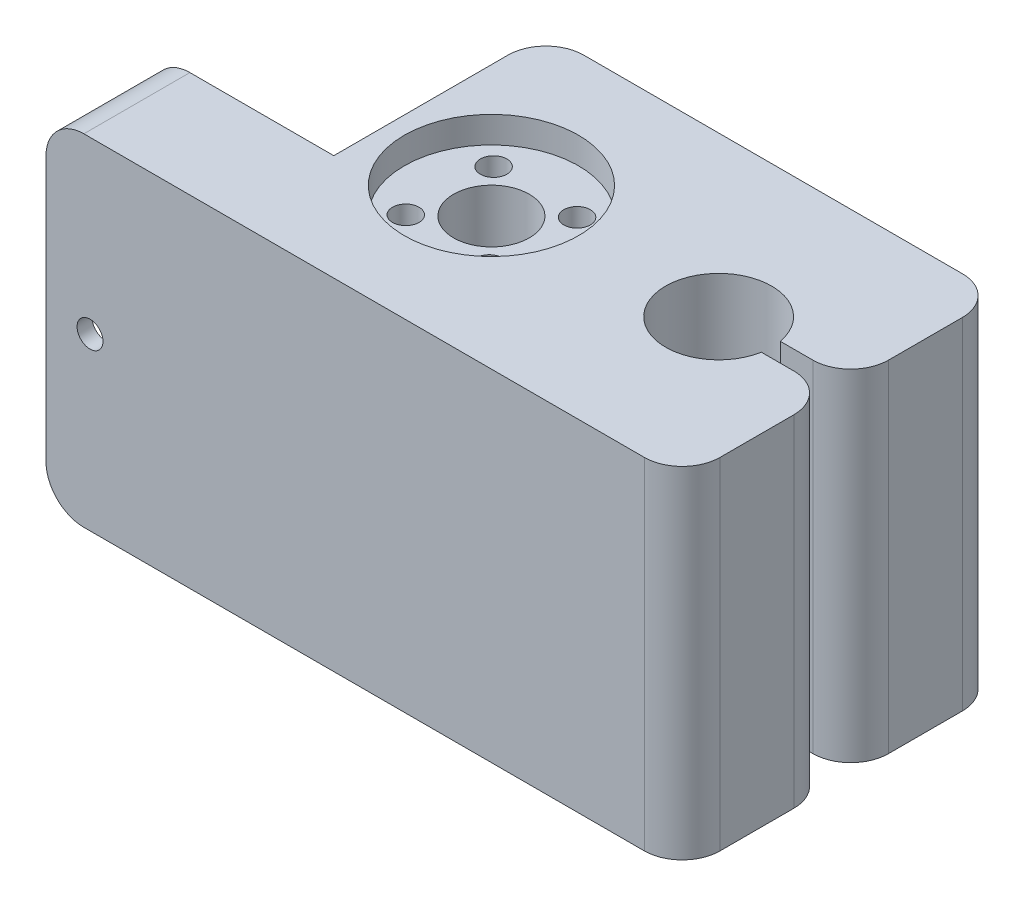
from build123d import *

# Parameters (mm, degrees)
SKETCH1_W           = 84
SKETCH1_H           = 45
BOSS_EXTRUDE1_DEPTH = 42
SKETCH3_W           = 24
SKETCH3_H           = 28
CUT_EXTRUDE2_DEPTH  = 105.139329746
SKETCH4_W           = 10
SKETCH4_H           = 17
CUT_EXTRUDE3_DEPTH  = 26
SKETCH7_R           = 11.5
CUT_EXTRUDE5_DEPTH  = 3.5
SKETCH11_R          = 1.75
CUT_EXTRUDE6_DEPTH  = 10
SKETCH12_R          = 5
CUT_EXTRUDE7_DEPTH  = 103.67545958
SKETCH13_R          = 7
CUT_EXTRUDE8_DEPTH  = 105.139329746
SKETCH14_W          = 20.693040582
SKETCH14_H          = 2.5
CUT_EXTRUDE9_DEPTH  = 105.139329746
FILLET2_R           = 5
SKETCH15_R          = 1.712332533
CUT_EXTRUDE10_DEPTH = 105.139329746


with BuildPart() as part:
    # Sketch1 → Boss-Extrude1 (new body)
    with BuildSketch(Plane.XY):
        with Locations((42, 22.5)):
            Rectangle(SKETCH1_W, SKETCH1_H)
    extrude(amount=BOSS_EXTRUDE1_DEPTH)

    # Sketch3 → Cut-Extrude2 (cut, through all)
    with BuildSketch(Plane(origin=(0, 45, 0), x_dir=(1, 0, 0), z_dir=(0, 1, 0))):
        with Locations((12, -14)):
            Rectangle(SKETCH3_W, SKETCH3_H)
    extrude(amount=-CUT_EXTRUDE2_DEPTH, mode=Mode.SUBTRACT)

    # Sketch4 → Cut-Extrude3 (cut)
    with BuildSketch(Plane.ZY):
        with Locations((35, 22.5)):
            Rectangle(SKETCH4_W, SKETCH4_H)
    extrude(amount=-CUT_EXTRUDE3_DEPTH, mode=Mode.SUBTRACT)

    # Sketch7 → Cut-Extrude5 (cut)
    with BuildSketch(Plane(origin=(0, 45, 0), x_dir=(1, 0, 0), z_dir=(0, 1, 0))):
        with Locations((37.813118429, -21)):
            Circle(SKETCH7_R)
    extrude(amount=-CUT_EXTRUDE5_DEPTH, mode=Mode.SUBTRACT)

    # Sketch11 → Cut-Extrude6 (cut)
    with BuildSketch(Plane(origin=(0, 41.5, 0), x_dir=(1, 0, 0), z_dir=(0, 1, 0))):
        with Locations((32.014758107, -26.511716392)):
            Circle(SKETCH11_R)
        with Locations((32.301402037, -15.201639679)):
            Circle(SKETCH11_R)
        with Locations((43.61147875, -15.488283608)):
            Circle(SKETCH11_R)
        with Locations((43.32483482, -26.798360321)):
            Circle(SKETCH11_R)
    extrude(amount=-CUT_EXTRUDE6_DEPTH, mode=Mode.SUBTRACT)

    # Sketch12 → Cut-Extrude7 (cut, through all)
    with BuildSketch(Plane(origin=(0, 41.5, 0), x_dir=(1, 0, 0), z_dir=(0, 1, 0))):
        with Locations((37.813118429, -21)):
            Circle(SKETCH12_R)
    extrude(amount=-CUT_EXTRUDE7_DEPTH, mode=Mode.SUBTRACT)

    # Sketch13 → Cut-Extrude8 (cut, through all)
    with BuildSketch(Plane(origin=(0, 45, 0), x_dir=(1, 0, 0), z_dir=(0, 1, 0))):
        with Locations((67.813118429, -21)):
            Circle(SKETCH13_R)
    extrude(amount=-CUT_EXTRUDE8_DEPTH, mode=Mode.SUBTRACT)

    # Sketch14 → Cut-Extrude9 (cut, through all)
    with BuildSketch(Plane(origin=(0, 45, 0), x_dir=(1, 0, 0), z_dir=(0, 1, 0))):
        with Locations((73.653479709, -21)):
            Rectangle(SKETCH14_W, SKETCH14_H)
    extrude(amount=-CUT_EXTRUDE9_DEPTH, mode=Mode.SUBTRACT)

    # Fillet2
    fillet2_edges = [part.edges().sort_by_distance(p)[0] for p in [
        (24, 22.5, 0),
        (84, 22.5, 0),
        (84, 22.5, 42),
        (0, 0, 35),
        (0, 45, 35),
        (84, 22.5, 22.25),
        (84, 22.5, 19.75),
    ]]
    fillet(fillet2_edges, radius=FILLET2_R)

    # Sketch15 → Cut-Extrude10 (cut, through all)
    with BuildSketch(Plane.XY.offset(42)):
        with Locations((5.813118429, 22.5)):
            Circle(SKETCH15_R)
    extrude(amount=-CUT_EXTRUDE10_DEPTH, mode=Mode.SUBTRACT)


solid = part.part
